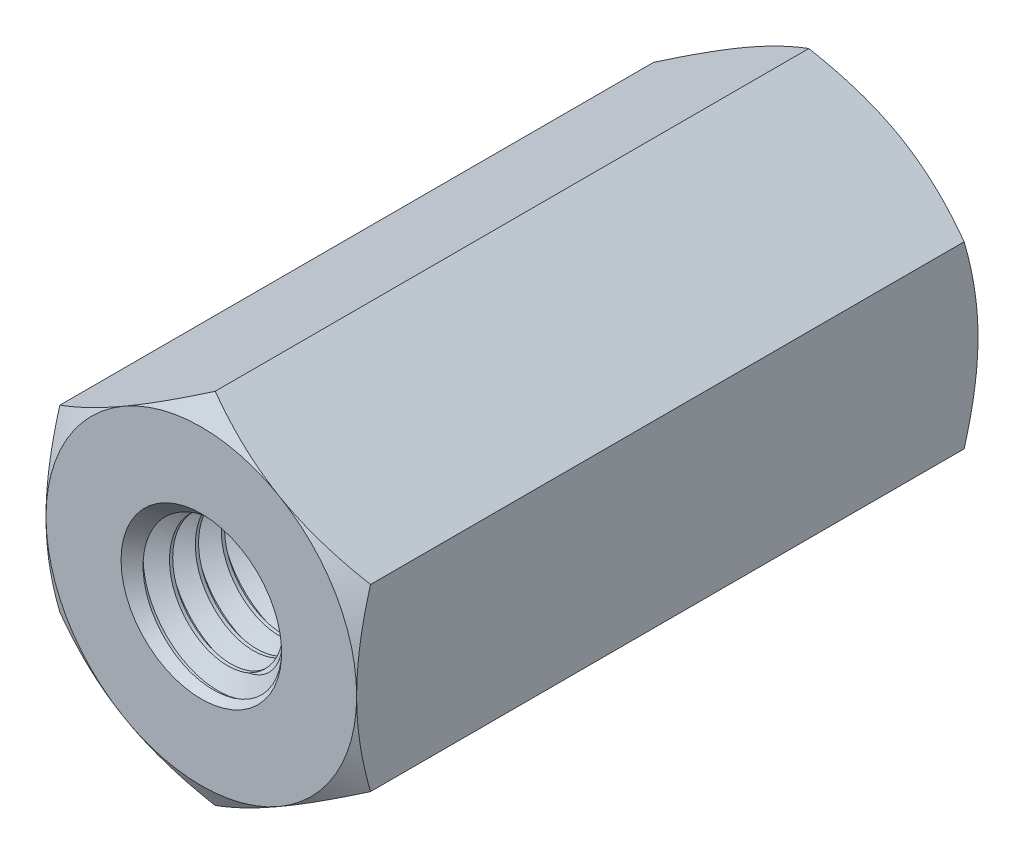
from build123d import *

# Parameters (mm, degrees)
EXTRUDE1_DEPTH          = 6
EXTRUDE1_DEPTH_BACK     = 6
SKETCH1_R               = 1.5
SWEEP1_PITCH            = 0.5
EXTRUDE2_DEPTH          = 14.31368972
SKETCH8_OUTSIDE_W       = 60.684
SKETCH8_OUTSIDE_H       = 61.612
SKETCH8_OUTSIDE_R       = 3
EXTRUDE4_DEPTH          = 14.31368972
EXTRUDE4_DRAFT          = -60
MIRROR1_COPY_1_SKETCH_W = 60.684
MIRROR1_COPY_1_SKETCH_H = 61.612
MIRROR1_COPY_1_SKETCH_R = 3
MIRROR1_COPY_1_DEPTH    = 14.31368972
MIRROR1_COPY_1_DRAFT    = -60


with BuildPart() as part:
    # Sketch1 → Extrude1 (new, two sides: drawn at the far end of the back side and taken through both)
    with BuildSketch(Plane.XY.offset(-EXTRUDE1_DEPTH_BACK)):
        Polygon((0, 3.464101615), (-3, 1.732050808), (-3, -1.732050808), (0, -3.464101615), (3, -1.732050808), (3, 1.732050808), align=None)
        Circle(SKETCH1_R, mode=Mode.SUBTRACT)
    extrude(amount=EXTRUDE1_DEPTH + EXTRUDE1_DEPTH_BACK)

    # Sweep1: the profile of Sketch12 profile screwed along a right-hand helix of 25 turns, 6 arcs to a turn; built about Z, then put on its axis
    sweep1_z = Axis((0, 0, 0), (0, 0, 1))
    sweep1_corners = [(1.5003, 0, -0.437673205), (1.5003, 0, 0.000173205), (1.175240474, 0, -0.1875), (1.175240474, 0, -0.25)]
    with BuildLine(mode=Mode.PRIVATE) as sweep1_profile:
        Line(sweep1_corners[0], sweep1_corners[1])
        Line(sweep1_corners[1], sweep1_corners[2])
        Line(sweep1_corners[2], sweep1_corners[3])
        Line(sweep1_corners[3], sweep1_corners[0])
    sweep1_cap = Face(sweep1_profile.wire())
    sweep1_turn_angles = [0, 30, 60, 90, 120, 150, 180, 210, 240, 270, 300, 330, 360]
    sweep1_turn_weights = [1, 0.8660254037844387, 1, 0.8660254037844387, 1, 0.8660254037844387, 1, 0.8660254037844387, 1, 0.8660254037844387, 1, 0.8660254037844387, 1]
    sweep1_turn_rails = [Edge.make_bspline([Vector(p[0], p[1], 0).rotate(sweep1_z, sweep1_turn_angles[k]) / sweep1_turn_weights[k] + Vector(0, 0, p[2] + SWEEP1_PITCH * sweep1_turn_angles[k] / 360) for k in range(13)], [0, 0, 0, 1, 1, 2, 2, 3, 3, 4, 4, 5, 5, 6, 6, 6], 2, sweep1_turn_weights) for p in sweep1_corners]
    sweep1_turn_sides = [Face.make_surface_from_curves(sweep1_turn_rails[p[0]], sweep1_turn_rails[p[1]]) for p in [(0, 1), (1, 2), (2, 3), (3, 0)]]
    sweep1 = Plane(origin=(0, 0, -6), x_dir=(0, 1, 0), z_dir=(0, 0, 1)) * Solid(Shell([*[p.moved(Location((0, 0, SWEEP1_PITCH * i))) for i in range(25) for p in sweep1_turn_sides], sweep1_cap, sweep1_cap.rotate(sweep1_z, 9000).moved(Location((0, 0, SWEEP1_PITCH * 9000 / 360)))]))
    add(sweep1)

    # Sketch6 → Extrude2 (cut, through all)
    with BuildSketch(Plane(origin=(0, 0, -6), x_dir=(-1, 0, 0), z_dir=(0, 0, -1))):
        Polygon((0, 3.464101615), (-3, 1.732050808), (-3, -1.732050808), (0, -3.464101615), (3, -1.732050808), (3, 1.732050808), align=None)
    extrude2 = extrude(amount=EXTRUDE2_DEPTH, mode=Mode.SUBTRACT)

    # Extrude3 cone 1 section (through the dimple's axis) → Extrude3 (revolve, cut)
    with BuildSketch(Plane(origin=(0, 0, -6), x_dir=(0, 1, 0), z_dir=(1, 0, 0))):
        Polygon((0, 0), (1.5508, 0), (0, 1.663029396), align=None)
    extrude3 = revolve(axis=Axis((0, 0, -6), (0, 0, 1)), mode=Mode.SUBTRACT)


with BuildPart() as extrude4_tool:
    # Sketch8 outside → Extrude4 (with draft: the straight prism first)
    with BuildSketch(Plane(origin=(0, 0, -6), x_dir=(-1, 0, 0), z_dir=(0, 0, -1))):
        Rectangle(SKETCH8_OUTSIDE_W, SKETCH8_OUTSIDE_H)
        Circle(SKETCH8_OUTSIDE_R, mode=Mode.SUBTRACT)
    extrude(amount=-EXTRUDE4_DEPTH)
    # Extrude4: the draft: its side faces are tilted about the plane it starts from
    extrude4_sides = [extrude4_tool.faces().sort_by_distance(p)[0] for p in [
        (0, -30.806, 1.15684486),
        (-30.342, 0, 1.15684486),
        (0, 30.806, 1.15684486),
        (30.342, 0, 1.15684486),
        (3, 0, 1.15684486),
    ]]
    draft(extrude4_sides, Plane(origin=(0, 0, -6), x_dir=(-1, 0, 0), z_dir=(0, 0, -1)), EXTRUDE4_DRAFT)


with BuildPart() as part_1:
    add(part.part)

    # Extrude4: cut by extrude4_tool
    add(extrude4_tool.part, mode=Mode.SUBTRACT)

    # Mirror1: Extrude2, Extrude3 across plane
    add(extrude2.mirror(Plane.XY), mode=Mode.SUBTRACT)
    add(extrude3.mirror(Plane.XY), mode=Mode.SUBTRACT)


with BuildPart() as mirror1_copy_1_tool:
    # Mirror1 copy 1 sketch → Mirror1 copy 1 (with draft: the straight prism first)
    with BuildSketch(Plane(origin=(0, 0, 6), x_dir=(-1, 0, 0), z_dir=(0, 0, 1))):
        Rectangle(MIRROR1_COPY_1_SKETCH_W, MIRROR1_COPY_1_SKETCH_H)
        Circle(MIRROR1_COPY_1_SKETCH_R, mode=Mode.SUBTRACT)
    extrude(amount=-MIRROR1_COPY_1_DEPTH)
    # Mirror1 copy 1: the draft: its side faces are tilted about the plane it starts from
    mirror1_copy_1_sides = [mirror1_copy_1_tool.faces().sort_by_distance(p)[0] for p in [
        (0, -30.806, -1.15684486),
        (-30.342, 0, -1.15684486),
        (0, 30.806, -1.15684486),
        (30.342, 0, -1.15684486),
        (3, 0, -1.15684486),
    ]]
    draft(mirror1_copy_1_sides, Plane(origin=(0, 0, 6), x_dir=(-1, 0, 0), z_dir=(0, 0, 1)), MIRROR1_COPY_1_DRAFT)


with BuildPart() as part_2:
    add(part_1.part)

    # Mirror1 copy 1: cut by mirror1_copy_1_tool
    add(mirror1_copy_1_tool.part, mode=Mode.SUBTRACT)


solid = part_2.part
